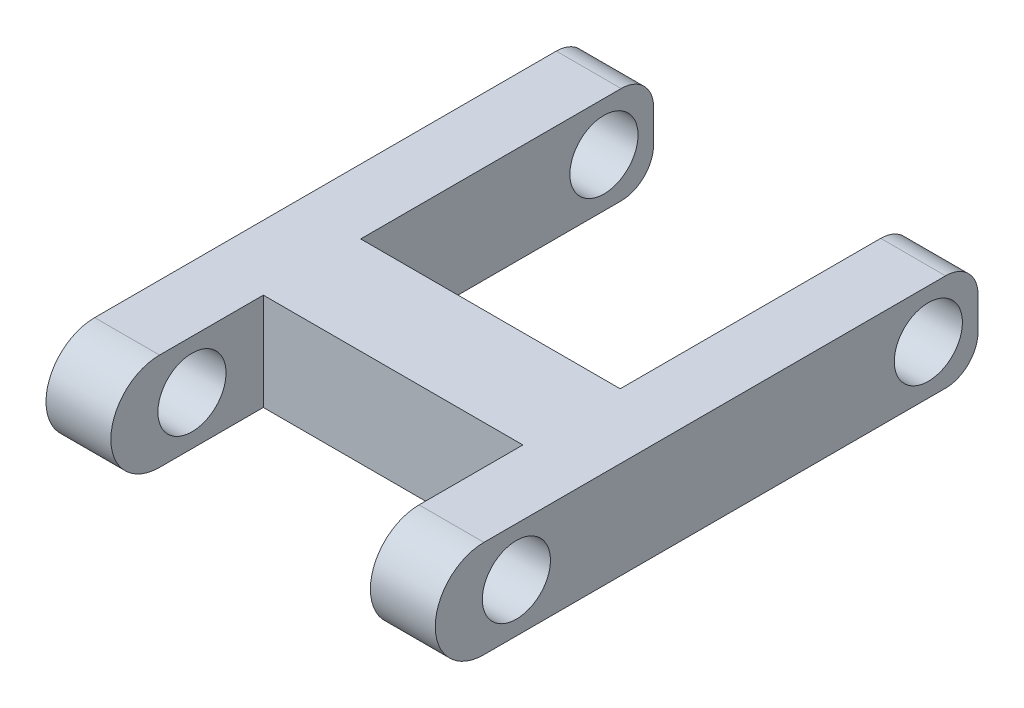
from build123d import *

# Parameters (mm, degrees)
EXTRUDE_1_DEPTH     = 3
SKETCH_2_OUTSIDE_W  = 13.724
SKETCH_2_OUTSIDE_H  = 8.024
CUT_EXTRUDE_1_DEPTH = 12
SKETCH_3_R          = 1.05
CUT_EXTRUDE_2_DEPTH = 12
FILLET_1_R          = 1
SKETCH_4_R          = 0.95
EXTRUDE_2_DEPTH     = 4
SKETCH_5_W          = 12
SKETCH_5_H          = 3
EXTRUDE_3_DEPTH     = 8
SKETCH_6_R          = 1.05
CUT_EXTRUDE_3_DEPTH = 12
CUT_EXTRUDE_4_DEPTH = 14.747727085
FILLET_2_R          = 1
SKETCH_9_W          = 11.8
SKETCH_9_H          = 3
EXTRUDE_4_DEPTH     = 4
SKETCH_10_W         = 8
SKETCH_10_H         = 4
CUT_EXTRUDE_5_DEPTH = 10
SKETCH_12_W         = 12
SKETCH_12_H         = 3
EXTRUDE_5_DEPTH     = 2
FILLET_3_R          = 1
SKETCH_13_W         = 12
SKETCH_13_H         = 2.969780185
CUT_EXTRUDE_6_DEPTH = 14.747727085
FILLET_4_R          = 1
SKETCH_15_W         = 8
SKETCH_15_H         = 4
CUT_EXTRUDE_7_DEPTH = 12.249216413
SKETCH_16_W         = 2
SKETCH_16_H         = 4.595961916
EXTRUDE_6_DEPTH     = 3


with BuildPart() as part:
    # 草图1 → 凸台-拉伸1 (new body)
    with BuildSketch(Plane(origin=(0, 0, 0), x_dir=(1, 0, 0), z_dir=(0, 1, 0))):
        Polygon((-6, 0), (6, 0), (6, -8.7), (4, -8.7), (4, -3), (-4, -3), (-4, -8.7), (-6, -8.7), align=None)
    extrude(amount=EXTRUDE_1_DEPTH)

    # 草图2 outside → 切除-拉伸1 (cut)
    with BuildSketch(Plane.ZY.offset(6)):
        with Locations((4.35, 1.5)):
            Rectangle(SKETCH_2_OUTSIDE_W, SKETCH_2_OUTSIDE_H)
        with BuildLine():
            Line((6.2, 3), (0, 3))
            Line((0, 3), (0, 0))
            Line((0, 0), (6.2, 0))
            ThreePointArc((6.2, 0), (7.7, 1.5), (6.2, 3))
        make_face(mode=Mode.SUBTRACT)
    extrude(amount=-CUT_EXTRUDE_1_DEPTH, mode=Mode.SUBTRACT)

    # 草图3 → 切除-拉伸2 (cut)
    with BuildSketch(Plane.ZY.offset(6)):
        with Locations((5.2, 1.5)):
            Circle(SKETCH_3_R)
    extrude(amount=-CUT_EXTRUDE_2_DEPTH, mode=Mode.SUBTRACT)

    # 圆角1
    fillet_1_edges = [part.edges().sort_by_distance(p)[0] for p in [
        (-6, 1.5, 0),
        (6, 1.5, 0),
    ]]
    fillet(fillet_1_edges, radius=FILLET_1_R)

    # 草图4 → 凸台-拉伸2 (add)
    with BuildSketch(Plane(origin=(0, 0, 0), x_dir=(-1, 0, 0), z_dir=(0, 0, -1))):
        with Locations(Location((0, 1.5, 0), (0, 0, 180))):
            Circle(SKETCH_4_R)
    extrude(amount=EXTRUDE_2_DEPTH)

    # 草图5 → 凸台-拉伸3 (add)
    with BuildSketch(Plane(origin=(0, 0, -4), x_dir=(-1, 0, 0), z_dir=(0, 0, -1))):
        with Locations((0, 1.5)):
            Rectangle(SKETCH_5_W, SKETCH_5_H)
    extrude(amount=EXTRUDE_3_DEPTH)

    # 草图6 → 切除-拉伸3 (cut)
    with BuildSketch(Plane(origin=(6, 0, 0), x_dir=(0, 0, -1), z_dir=(1, 0, 0))):
        with Locations((7.5, 1.5)):
            Circle(SKETCH_6_R)
    extrude(amount=-CUT_EXTRUDE_3_DEPTH, mode=Mode.SUBTRACT)

    # 草图8 → 切除-拉伸4 (cut, through all)
    with BuildSketch(Plane(origin=(0, 3, 0), x_dir=(1, 0, 0), z_dir=(0, 1, 0))):
        Polygon((-1.5, 8), (1.5, 8), (4, 8), (4, 12), (1.5, 12), (-1.5, 12), (-4, 12), (-4, 8), align=None)
    extrude(amount=-CUT_EXTRUDE_4_DEPTH, mode=Mode.SUBTRACT)

    # 圆角2
    fillet_2_edges = [part.edges().sort_by_distance(p)[0] for p in [
        (-5, 0, -12),
        (5, 0, -12),
    ]]
    fillet(fillet_2_edges, radius=FILLET_2_R)

    # 草图9 → 凸台-拉伸4 (add)
    with BuildSketch(Plane.XY.offset(-4)):
        with Locations((0, 1.5)):
            Rectangle(SKETCH_9_W, SKETCH_9_H)
    extrude(amount=EXTRUDE_4_DEPTH)

    # 草图10 → 切除-拉伸5 (cut)
    with BuildSketch(Plane(origin=(0, 3, 0), x_dir=(1, 0, 0), z_dir=(0, 1, 0))):
        with Locations((0, 6)):
            Rectangle(SKETCH_10_W, SKETCH_10_H)
    extrude(amount=-CUT_EXTRUDE_5_DEPTH, mode=Mode.SUBTRACT)

    # 草图12 → 凸台-拉伸5 (add)
    with BuildSketch(Plane.XY.offset(-4)):
        with Locations((0, 1.5)):
            Rectangle(SKETCH_12_W, SKETCH_12_H)
    extrude(amount=EXTRUDE_5_DEPTH)

    # 圆角3
    # the kernel refuses this fillet: 1 mm, written as the material it takes off along each edge
    with BuildSketch(Plane(origin=(6, 4.089724736, -2), x_dir=(0, 0, -1), z_dir=(0, -1, 0)), Plane(origin=(-6, -1.089724736, -2), x_dir=(0, 0, -1), z_dir=(0, 1, 0))) as fillet_3_piece_1:
        with BuildLine():
            CenterArc((0.435889894, -1), FILLET_3_R, 90, 25.841932763)
            Line((0, -0.1), (-0.008717798, -0.082))
            ThreePointArc((-0.008717798, -0.082), (-0.02, -0.05), (-0.02, 0))
            Line((-0.02, 0), (0, 0.02))
            Line((0, 0.02), (0.435889894, 0.02))
            Line((0.435889894, 0.02), (0.435889894, 0))
        make_face()
    extrude(amount=5.179449472, mode=Mode.SUBTRACT)

    # 草图13 → 切除-拉伸6 (cut, through all)
    with BuildSketch(Plane.XZ):
        with Locations((0, -10.515109908)):
            Rectangle(SKETCH_13_W, SKETCH_13_H)
    extrude(amount=-CUT_EXTRUDE_6_DEPTH, mode=Mode.SUBTRACT)

    # 圆角4
    fillet_4_edges = [part.edges().sort_by_distance(p)[0] for p in [
        (5, 3, -9.030219815),
        (-5, 3, -9.030219815),
        (5, 0, -9.030219815),
        (-5, 0, -9.030219815),
    ]]
    fillet(fillet_4_edges, radius=FILLET_4_R)

    # 草图15 → 切除-拉伸7 (cut, through all)
    with BuildSketch(Plane.XZ):
        with Locations((0, -2)):
            Rectangle(SKETCH_15_W, SKETCH_15_H)
    extrude(amount=-CUT_EXTRUDE_7_DEPTH, mode=Mode.SUBTRACT)

    # 草图16 → 凸台-拉伸6 (add, through all)
    with BuildSketch(Plane.XZ):
        with Locations((-5, -0.242379669)):
            Rectangle(SKETCH_16_W, SKETCH_16_H)
        with Locations((5, -0.242379669)):
            Rectangle(SKETCH_16_W, SKETCH_16_H)
    extrude(amount=-EXTRUDE_6_DEPTH)


solid = part.part
